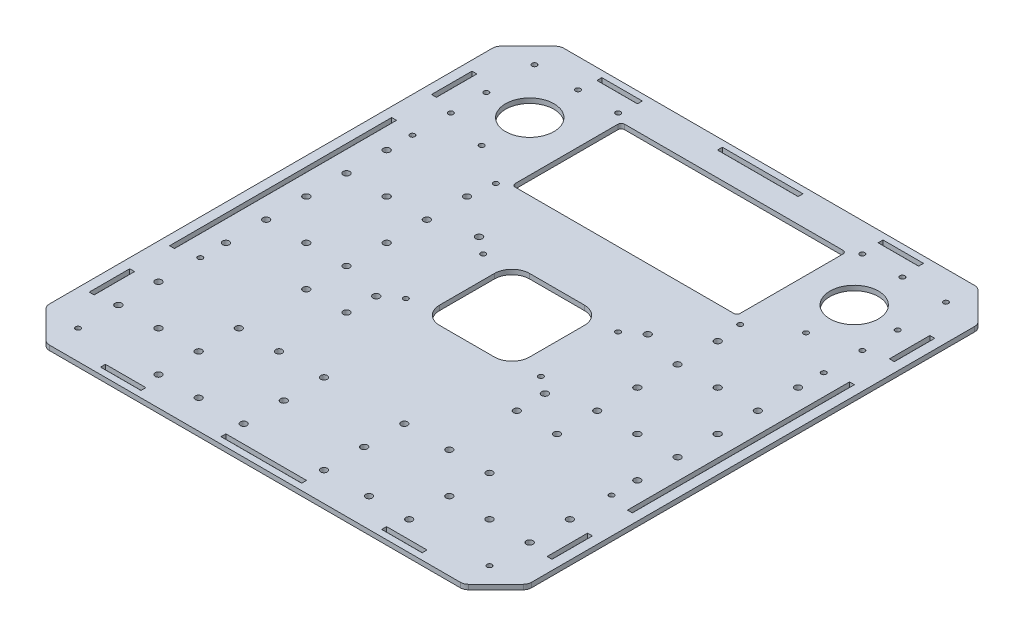
from build123d import *

# Parameters (mm, degrees)
SKETCH1_R          = 2.075
BASE_FLANGE1_DEPTH = 3
SKETCH6_R          = 1.55
SKETCH6_W          = 25.2
SKETCH6_H          = 3.05
SKETCH6_W_2        = 3.05
SKETCH6_H_2        = 25.2
SKETCH6_W_3        = 50.2
CUT_EXTRUDE1_DEPTH = 10
SKETCH7_R          = 1.55
SKETCH7_R_2        = 15.05
CUT_EXTRUDE2_DEPTH = 10
SKETCH8_R          = 2.05
CUT_EXTRUDE3_DEPTH = 10


# Sheet-metal steps are written as plain solids
with BuildPart() as part:
    # Sketch1 → Base-Flange1 (new body)
    with BuildSketch(Plane(origin=(0, 0, 0), x_dir=(1, 0, 0), z_dir=(0, 1, 0))):
        with BuildLine():
            Line((150, 137.928932188), (150, 56))
            Line((150, 56), (150, -56))
            Line((150, -56), (150, -137.928932188))
            ThreePointArc((150, -137.928932188), (149.619397663, -139.84234935), (148.535533906, -141.464466094))
            Line((148.535533906, -141.464466094), (131.464466094, -158.535533906))
            ThreePointArc((131.464466094, -158.535533906), (129.84234935, -159.619397663), (127.928932188, -160))
            Line((127.928932188, -160), (-127.928932188, -160))
            ThreePointArc((-127.928932188, -160), (-129.84234935, -159.619397663), (-131.464466094, -158.535533906))
            Line((-131.464466094, -158.535533906), (-148.535533906, -141.464466094))
            ThreePointArc((-148.535533906, -141.464466094), (-149.619397663, -139.84234935), (-150, -137.928932188))
            Line((-150, -137.928932188), (-150, -56))
            Line((-150, -56), (-150, 56))
            Line((-150, 56), (-150, 137.928932188))
            ThreePointArc((-150, 137.928932188), (-149.619397663, 139.84234935), (-148.535533906, 141.464466094))
            Line((-148.535533906, 141.464466094), (-131.464466094, 158.535533906))
            ThreePointArc((-131.464466094, 158.535533906), (-129.84234935, 159.619397663), (-127.928932188, 160))
            Line((-127.928932188, 160), (127.928932188, 160))
            ThreePointArc((127.928932188, 160), (129.84234935, 159.619397663), (131.464466094, 158.535533906))
            Line((131.464466094, 158.535533906), (148.535533906, 141.464466094))
            ThreePointArc((148.535533906, 141.464466094), (149.619397663, 139.84234935), (150, 137.928932188))
        make_face()
        with Locations(Location((52.5, 32, 0), (0, 0, 270))):
            Circle(SKETCH1_R, mode=Mode.SUBTRACT)
        with Locations(Location((52.5, -32, 0), (0, 0, 90))):
            Circle(SKETCH1_R, mode=Mode.SUBTRACT)
        with Locations(Location((-52.5, -32, 0), (0, 0, 270))):
            Circle(SKETCH1_R, mode=Mode.SUBTRACT)
        with Locations(Location((-52.5, 32, 0), (0, 0, 90))):
            Circle(SKETCH1_R, mode=Mode.SUBTRACT)
    extrude(amount=-BASE_FLANGE1_DEPTH)

    # Sketch6 → Cut-Extrude1 (cut)
    with BuildSketch(Plane(origin=(0, 0, 0), x_dir=(1, 0, 0), z_dir=(0, 1, 0))):
        with Locations(Location((128, 142, 0), (0, 0, 270))):
            Circle(SKETCH6_R)
        with Locations(Location((-128, 142, 0), (0, 0, 90))):
            Circle(SKETCH6_R)
        with Locations(Location((-128, -142, 0), (0, 0, 270))):
            Circle(SKETCH6_R)
        with Locations(Location((128, -142, 0), (0, 0, 90))):
            Circle(SKETCH6_R)
        with Locations(Location((42, 24, 0), (0, 0, 270))):
            Circle(SKETCH6_R)
        with Locations(Location((42, -24, 0), (0, 0, 90))):
            Circle(SKETCH6_R)
        with Locations(Location((-42, 24, 0), (0, 0, 90))):
            Circle(SKETCH6_R)
        with Locations(Location((-42, -24, 0), (0, 0, 270))):
            Circle(SKETCH6_R)
        with Locations(Location((-128, -66, 0), (0, 0, 270))):
            Circle(SKETCH6_R)
        with Locations(Location((128, -66, 0), (0, 0, 90))):
            Circle(SKETCH6_R)
        with Locations(Location((128, 66, 0), (0, 0, 270))):
            Circle(SKETCH6_R)
        with Locations(Location((-128, 66, 0), (0, 0, 90))):
            Circle(SKETCH6_R)
        with Locations(Location((-128, 90, 0), (0, 0, 270))):
            Circle(SKETCH6_R)
        with Locations(Location((128, 90, 0), (0, 0, 90))):
            Circle(SKETCH6_R)
        with Locations((87.5, 154.475)):
            Rectangle(SKETCH6_W, SKETCH6_H)
        Polygon((144, 54), (144, -54), (144, -69.1), (140.95, -69.1), (140.95, -53.9), (140.95, 53.9), (140.95, 69.1), (144, 69.1), align=None)
        with BuildLine():
            Line((-17, -28), (17, -28))
            ThreePointArc((17, -28), (24.778174593, -24.778174593), (28, -17))
            Line((28, -17), (28, 17))
            ThreePointArc((28, 17), (24.778174593, 24.778174593), (17, 28))
            Line((17, 28), (-17, 28))
            ThreePointArc((-17, 28), (-24.778174593, 24.778174593), (-28, 17))
            Line((-28, 17), (-28, -17))
            ThreePointArc((-28, -17), (-24.778174593, -24.778174593), (-17, -28))
        make_face()
        with Locations((142.475, 106.5)):
            Rectangle(SKETCH6_W_2, SKETCH6_H_2)
        with Locations((0, 154.475)):
            Rectangle(SKETCH6_W_3, SKETCH6_H)
        with Locations((-87.5, 154.475)):
            Rectangle(SKETCH6_W, SKETCH6_H)
        Polygon((-144, 69.1), (-144, 54), (-144, -54), (-144, -69.1), (-140.95, -69.1), (-140.95, -53.9), (-140.95, 53.9), (-140.95, 69.1), align=None)
        with Locations((-142.475, 106.5)):
            Rectangle(SKETCH6_W_2, SKETCH6_H_2)
        with Locations((-142.475, -106.5)):
            Rectangle(SKETCH6_W_2, SKETCH6_H_2)
        with Locations((142.475, -106.5)):
            Rectangle(SKETCH6_W_2, SKETCH6_H_2)
        with Locations((87.5, -154.475)):
            Rectangle(SKETCH6_W, SKETCH6_H)
        with Locations((-87.5, -154.475)):
            Rectangle(SKETCH6_W, SKETCH6_H)
        with Locations((0, -154.475)):
            Rectangle(SKETCH6_W_3, SKETCH6_H)
    extrude(amount=-CUT_EXTRUDE1_DEPTH, mode=Mode.SUBTRACT)

    # Sketch7 → Cut-Extrude2 (cut)
    with BuildSketch(Plane(origin=(0, 0, 0), x_dir=(1, 0, 0), z_dir=(0, 1, 0))):
        with Locations(Location((76, 142, 0), (0, 0, 270))):
            Circle(SKETCH7_R)
        with Locations(Location((76, 66, 0), (0, 0, 270))):
            Circle(SKETCH7_R)
        with Locations(Location((-76, 142, 0), (0, 0, 90))):
            Circle(SKETCH7_R)
        with Locations(Location((-76, 66, 0), (0, 0, 90))):
            Circle(SKETCH7_R)
        with Locations(Location((-100.957746479, 112, 0), (0, 0, 270))):
            Circle(SKETCH7_R_2)
        with Locations(Location((100.957746479, 112, 0), (0, 0, 90))):
            Circle(SKETCH7_R_2)
        with Locations(Location((100.957746479, 142, 0), (0, 0, 270))):
            Circle(SKETCH7_R)
        with Locations(Location((100.957746479, 82, 0), (0, 0, 270))):
            Circle(SKETCH7_R)
        with Locations(Location((128, 112, 0), (0, 0, 270))):
            Circle(SKETCH7_R)
        with Locations(Location((-100.957746479, 142, 0), (0, 0, 90))):
            Circle(SKETCH7_R)
        with Locations(Location((-100.957746479, 82, 0), (0, 0, 90))):
            Circle(SKETCH7_R)
        with Locations(Location((-128, 112, 0), (0, 0, 90))):
            Circle(SKETCH7_R)
        with BuildLine():
            Line((-68, 70), (68, 70))
            ThreePointArc((68, 70), (69.414213562, 70.585786438), (70, 72))
            Line((70, 72), (70, 136))
            ThreePointArc((70, 136), (69.414213562, 137.414213562), (68, 138))
            Line((68, 138), (-68, 138))
            ThreePointArc((-68, 138), (-69.414213562, 137.414213562), (-70, 136))
            Line((-70, 136), (-70, 72))
            ThreePointArc((-70, 72), (-69.414213562, 70.585786438), (-68, 70))
        make_face()
    extrude(amount=-CUT_EXTRUDE2_DEPTH, mode=Mode.SUBTRACT)

    # Sketch8 → Cut-Extrude3 (cut)
    with BuildSketch(Plane(origin=(0, 0, 0), x_dir=(1, 0, 0), z_dir=(0, 1, 0))):
        with Locations(Location((-53, -50, 0), (0, 0, 270))):
            Circle(SKETCH8_R)
        with Locations(Location((-53, -142, 0), (0, 0, 270))):
            Circle(SKETCH8_R)
        with Locations(Location((-128, 50, 0), (0, 0, 270))):
            Circle(SKETCH8_R)
        with Locations(Location((-78, 50, 0), (0, 0, 270))):
            Circle(SKETCH8_R)
        with Locations(Location((-78, -142, 0), (0, 0, 270))):
            Circle(SKETCH8_R)
        with Locations(Location((-128, 0, 0), (0, 0, 270))):
            Circle(SKETCH8_R)
        with Locations(Location((-78, -25, 0), (0, 0, 270))):
            Circle(SKETCH8_R)
        with Locations(Location((-128, -92, 0), (0, 0, 270))):
            Circle(SKETCH8_R)
        with Locations(Location((-78, -92, 0), (0, 0, 270))):
            Circle(SKETCH8_R)
        with Locations(Location((-53, -92, 0), (0, 0, 270))):
            Circle(SKETCH8_R)
        with Locations(Location((-128, 25, 0), (0, 0, 270))):
            Circle(SKETCH8_R)
        with Locations(Location((-128, -25, 0), (0, 0, 270))):
            Circle(SKETCH8_R)
        with Locations(Location((-78, 25, 0), (0, 0, 270))):
            Circle(SKETCH8_R)
        with Locations(Location((-25, -92, 0), (0, 0, 270))):
            Circle(SKETCH8_R)
        with Locations(Location((-25, -142, 0), (0, 0, 270))):
            Circle(SKETCH8_R)
        with Locations(Location((-128, -50, 0), (0, 0, 270))):
            Circle(SKETCH8_R)
        with Locations(Location((53, -50, 0), (0, 0, 90))):
            Circle(SKETCH8_R)
        with Locations(Location((78, -50, 0), (0, 0, 90))):
            Circle(SKETCH8_R)
        with Locations(Location((-128, -117, 0), (0, 0, 270))):
            Circle(SKETCH8_R)
        with Locations(Location((-103, -25, 0), (0, 0, 270))):
            Circle(SKETCH8_R)
        with Locations(Location((-103, 25, 0), (0, 0, 270))):
            Circle(SKETCH8_R)
        with Locations(Location((-78, 0, 0), (0, 0, 270))):
            Circle(SKETCH8_R)
        with Locations(Location((-78, -50, 0), (0, 0, 270))):
            Circle(SKETCH8_R)
        with Locations(Location((-25, -117, 0), (0, 0, 270))):
            Circle(SKETCH8_R)
        with Locations(Location((-103, -117, 0), (0, 0, 270))):
            Circle(SKETCH8_R)
        with Locations(Location((-78, -117, 0), (0, 0, 270))):
            Circle(SKETCH8_R)
        with Locations(Location((78, 0, 0), (0, 0, 90))):
            Circle(SKETCH8_R)
        with Locations(Location((103, 25, 0), (0, 0, 90))):
            Circle(SKETCH8_R)
        with Locations(Location((103, -25, 0), (0, 0, 90))):
            Circle(SKETCH8_R)
        with Locations(Location((128, -50, 0), (0, 0, 90))):
            Circle(SKETCH8_R)
        with Locations(Location((78, 25, 0), (0, 0, 90))):
            Circle(SKETCH8_R)
        with Locations(Location((128, -25, 0), (0, 0, 90))):
            Circle(SKETCH8_R)
        with Locations(Location((128, 25, 0), (0, 0, 90))):
            Circle(SKETCH8_R)
        with Locations(Location((78, -25, 0), (0, 0, 90))):
            Circle(SKETCH8_R)
        with Locations(Location((128, 0, 0), (0, 0, 90))):
            Circle(SKETCH8_R)
        with Locations(Location((78, 50, 0), (0, 0, 90))):
            Circle(SKETCH8_R)
        with Locations(Location((128, 50, 0), (0, 0, 90))):
            Circle(SKETCH8_R)
        with Locations(Location((78, -117, 0), (0, 0, 90))):
            Circle(SKETCH8_R)
        with Locations(Location((103, -117, 0), (0, 0, 90))):
            Circle(SKETCH8_R)
        with Locations(Location((25, -117, 0), (0, 0, 90))):
            Circle(SKETCH8_R)
        with Locations(Location((128, -117, 0), (0, 0, 90))):
            Circle(SKETCH8_R)
        with Locations(Location((25, -142, 0), (0, 0, 90))):
            Circle(SKETCH8_R)
        with Locations(Location((25, -92, 0), (0, 0, 90))):
            Circle(SKETCH8_R)
        with Locations(Location((53, -92, 0), (0, 0, 90))):
            Circle(SKETCH8_R)
        with Locations(Location((78, -92, 0), (0, 0, 90))):
            Circle(SKETCH8_R)
        with Locations(Location((128, -92, 0), (0, 0, 90))):
            Circle(SKETCH8_R)
        with Locations(Location((78, -142, 0), (0, 0, 90))):
            Circle(SKETCH8_R)
        with Locations(Location((53, -142, 0), (0, 0, 90))):
            Circle(SKETCH8_R)
    extrude(amount=-CUT_EXTRUDE3_DEPTH, mode=Mode.SUBTRACT)


solid = part.part
